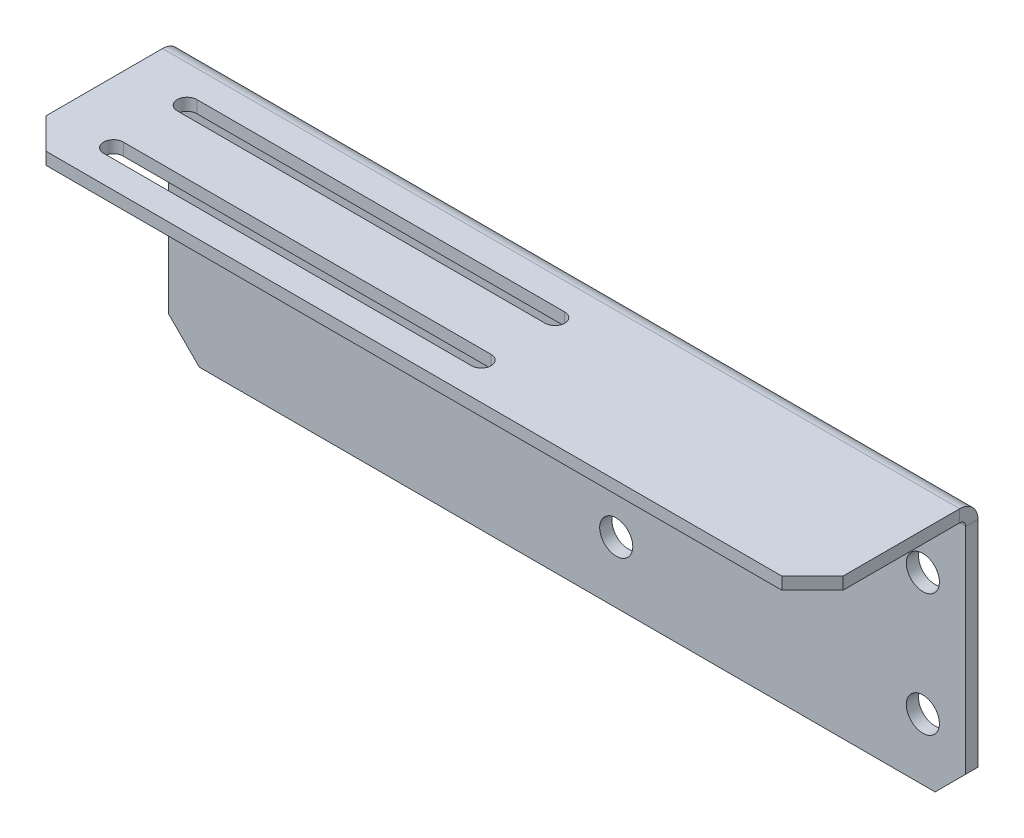
from build123d import *

# Parameters (mm, degrees)
SKETCH_17_W             = 130
SKETCH_17_H             = 40
SM_BASE_FLANGE_1_DEPTH  = 2
HOLE_WIZARD_5_4_5_4_1_D = 5.4
SM_EDGE_FLANGE_1_DEPTH  = 130
CUT_EXTRUDE_4_REACH     = 135.822
CHAMFER_1_SIZE          = 5


# Sheet-metal steps are written as plain solids
with BuildPart() as part:
    # 草圖17 → 基材-凸緣1 (new body)
    with BuildSketch(Plane.XY):
        with Locations((-58, 0)):
            Rectangle(SKETCH_17_W, SKETCH_17_H)
    extrude(amount=SM_BASE_FLANGE_1_DEPTH)

    # Ø5.4 (5.4) 直徑孔1 (through all)
    with Locations(Plane(origin=(-278.067262353, 19.151419807, 2), x_dir=(-1, 0, 0), z_dir=(0, 0, 1))):
        with Locations((-228.067262353, 29.151419807), (-278.067262353, 29.151419807), (-228.067262353, 9.151419807), (-278.067262353, 9.151419807)):
            Hole(HOLE_WIZARD_5_4_5_4_1_D / 2)

    # 邊線-凸緣1 section (across the edge) → 邊線-凸緣1 (add)
    with BuildSketch(Plane(origin=(7, 21, 2), x_dir=(0, -1, 0), z_dir=(-1, 0, 0))):
        with BuildLine():
            Line((-2, 1), (-2, 25))
            Line((-2, 25), (0, 25))
            Line((0, 25), (0, 1))
            ThreePointArc((0, 1), (0.292893219, 0.292893219), (1, 0))
            Line((1, 0), (1, -2))
            ThreePointArc((1, -2), (-1.121320344, -1.121320344), (-2, 1))
        make_face()
    extrude(amount=SM_EDGE_FLANGE_1_DEPTH)

    # 草圖14 → 除料-伸長4 (cut, up to next)
    with BuildSketch(Plane(origin=(0, 23, 30.5), x_dir=(1, 0, 0), z_dir=(0, 1, 0)), mode=Mode.PRIVATE) as cut_extrude_4_sk1:
        with BuildLine():
            Line((-113, 19.9), (-53, 19.9))
            ThreePointArc((-53, 19.9), (-51.4, 21.5), (-53, 23.1))
            Line((-53, 23.1), (-113, 23.1))
            ThreePointArc((-113, 23.1), (-114.6, 21.5), (-113, 19.9))
        make_face()
    cut_extrude_4_tool1 = extrude(cut_extrude_4_sk1.sketch, amount=-CUT_EXTRUDE_4_REACH, mode=Mode.PRIVATE) & part.part
    # 草圖14 → 除料-伸長4 (cut, up to next)
    with BuildSketch(Plane(origin=(0, 23, 30.5), x_dir=(1, 0, 0), z_dir=(0, 1, 0)), mode=Mode.PRIVATE) as cut_extrude_4_sk2:
        with BuildLine():
            Line((-113, 7.9), (-53, 7.9))
            ThreePointArc((-53, 7.9), (-51.4, 9.5), (-53, 11.1))
            Line((-53, 11.1), (-113, 11.1))
            ThreePointArc((-113, 11.1), (-114.6, 9.5), (-113, 7.9))
        make_face()
    cut_extrude_4_tool2 = extrude(cut_extrude_4_sk2.sketch, amount=-CUT_EXTRUDE_4_REACH, mode=Mode.PRIVATE) & part.part
    add(cut_extrude_4_tool1.solids().sort_by_distance((-83, 23, 9))[0], mode=Mode.SUBTRACT)
    add(cut_extrude_4_tool2.solids().sort_by_distance((-83, 23, 21))[0], mode=Mode.SUBTRACT)

    # 導角1
    chamfer_1_edges = [part.edges().sort_by_distance(p)[0] for p in [
        (7, 22, 27),
        (-123, 22, 27),
        (7, -20, 1),
        (-123, -20, 1),
    ]]
    chamfer(chamfer_1_edges, length=CHAMFER_1_SIZE)


solid = part.part
